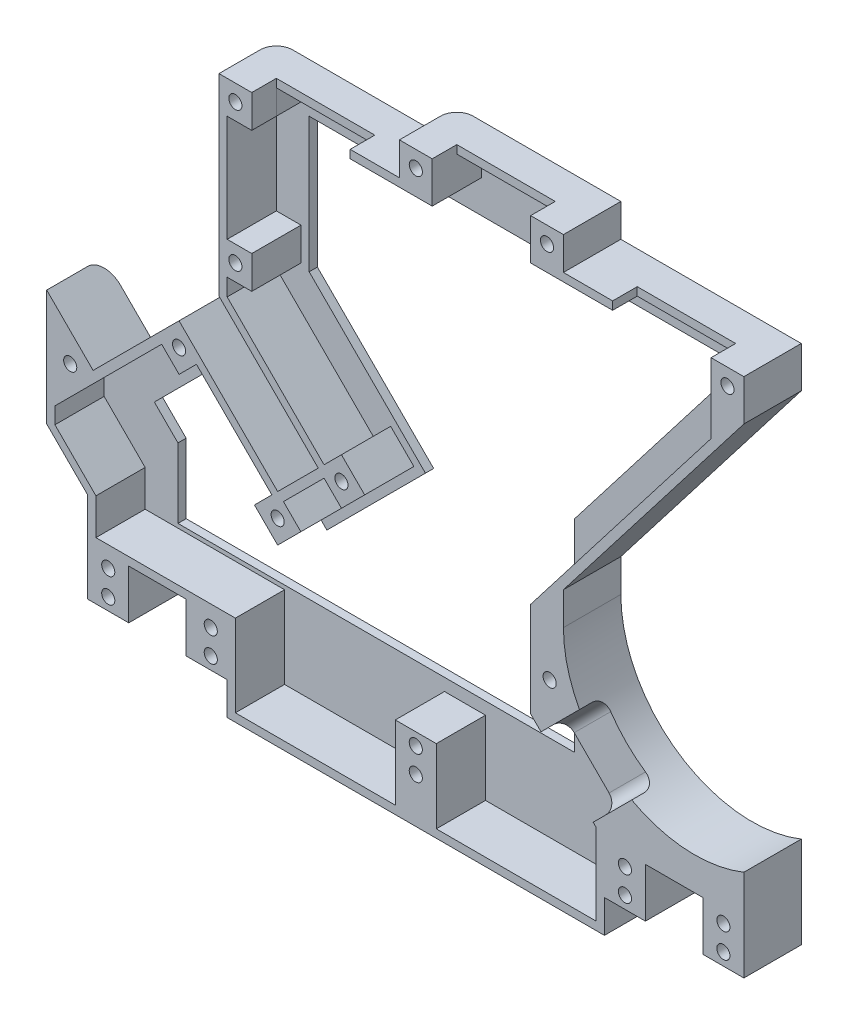
from build123d import *

# Parameters (mm, degrees)
BOSS_EXTRUDE1_DEPTH        = 1
BOSS_EXTRUDE3_DEPTH        = 7
FILLET1_R                  = 2
SKETCH5_R                  = 0.8
SCREW_HOLES_DEPTH          = 112.293530815
TUBE_START                 = 7
SKETCH6_W                  = 12
SKETCH6_H                  = 3.999999998
SKETCH6_H_2                = 3.99989697
TUBE_OPENINGS_FINGER_DEPTH = 3
TUBE_OPENINGS_THUMB_DEPTH  = 7
CUT_EXTRUDE1_DEPTH         = 112.293530962


with BuildPart() as part:
    # Sketch1 → Boss-Extrude1 (new body)
    with BuildSketch(Plane.XY):
        with BuildLine():
            Line((21, 67.500000006), (21, 43.999896977))
            Line((21, 43.999896977), (33.106562233, 31.893334743))
            Line((33.106562233, 31.893334743), (28.156814765, 26.943587275))
            Line((28.156814765, 26.943587275), (16.135999485, 38.964402555))
            Line((16.135999485, 38.964402555), (5.656854249, 28.48525732))
            Line((5.656854249, 28.48525732), (0, 34.14211157))
            Line((0, 34.14211157), (0, 20.000000004))
            Line((0, 20.000000004), (5, 15.000000004))
            Line((5, 15.000000004), (5, 10.000000004))
            Line((5, 10.000000004), (22, 10.000000004))
            Line((22, 10.000000004), (22, 4e-09))
            Line((22, 4e-09), (68, 4e-09))
            Line((68, 4e-09), (68, 10.000000004))
            Line((68, 10.000000004), (85, 10.000000004))
            Line((85, 10.000000004), (85, 15.167603026))
            ThreePointArc((85, 15.167603026), (70.05572809, 16.733500841), (63, 30.000000002))
            Line((63, 30.000000002), (63, 34.000000006))
            Line((63, 34.000000006), (85, 62.500000006))
            Line((85, 62.500000006), (85, 67.500000006))
            Line((85, 67.500000006), (63, 67.500000006))
            Line((63, 67.500000006), (63, 71.500000009))
            Line((63, 71.500000009), (43, 71.500000009))
            Line((43, 71.500000009), (43, 67.500000006))
            Line((43, 67.500000006), (21, 67.500000006))
        make_face()
    extrude(amount=BOSS_EXTRUDE1_DEPTH)

    # Sketch4 → Boss-Extrude3 (add)
    with BuildSketch(Plane.XY):
        with BuildLine():
            Line((21, 67.500000001), (21, 43.999896972))
            Line((21, 43.999896972), (33.106562233, 31.893334739))
            Line((33.106562233, 31.893334739), (28.156814765, 26.943587271))
            Line((28.156814765, 26.943587271), (16.135999485, 38.964402551))
            Line((16.135999485, 38.964402551), (5.656854249, 28.485257316))
            Line((5.656854249, 28.485257316), (0, 34.142111565))
            Line((0, 34.142111565), (0, 20))
            Line((0, 20), (5, 15))
            Line((5, 15), (5, 4))
            Line((5, 4), (10, 4))
            Line((10, 4), (10, 10))
            Line((10, 10), (17, 10))
            Line((17, 10), (17, 4))
            Line((17, 4), (22, 4))
            Line((22, 4), (22, 0))
            Line((22, 0), (68, 0))
            Line((68, 0), (68, 4))
            Line((68, 4), (73, 4))
            Line((73, 4), (73, 10))
            Line((73, 10), (80, 10))
            Line((80, 10), (80, 4))
            Line((80, 4), (85, 4))
            Line((85, 4), (85, 10))
            Line((85, 10), (85, 15.167603026))
            ThreePointArc((85, 15.167603026), (70.05572809, 16.733500841), (63, 30.000000002))
            Line((63, 30.000000002), (63, 34.000000006))
            Line((63, 34.000000006), (85, 62.500000006))
            Line((85, 62.500000006), (85, 67.500000004))
            Line((85, 67.500000004), (63, 67.500000004))
            Line((63, 67.500000004), (63, 71.500000004))
            Line((63, 71.500000004), (43, 71.500000004))
            Line((43, 71.500000004), (43, 67.500000001))
            Line((43, 67.500000001), (21, 67.500000001))
        make_face()
        Polygon((25, 66.500000001), (47, 66.500000001), (47, 70.500000001), (59, 70.500000001), (59, 66.500000001), (81, 66.500000001), (81, 58.954703281), (59.000000001, 30.454703282), (59.000000001, 18.88730163), (67, 10.887301631), (67, 1.000000001), (47.5, 1.000000001), (47.5, 9.999896972), (42.5, 9.999896972), (42.5, 1.000000001), (23, 1.000000001), (23, 11.000000001), (6, 11.000000001), (6, 15.414213562), (1, 20.414213562), (1, 22.414189504), (14.014679141, 35.428868645), (16.135999485, 33.307548301), (18.257319828, 35.428868645), (27.449707984, 26.23648049), (25.32838764, 24.115160146), (28.156814765, 21.286733021), (30.98524189, 24.115160146), (28.863921546, 26.23648049), (33.813669014, 31.186227958), (35.934989358, 29.064907614), (38.763416483, 31.893334739), (35.934989358, 34.721761864), (33.813669014, 32.60044152), (22, 44.414110535), (22, 46.499896972), (25, 46.499896972), (25, 50.499896972), (22, 50.499896972), (22, 63.500000001), (25, 63.500000001), align=None, mode=Mode.SUBTRACT)
    extrude(amount=BOSS_EXTRUDE3_DEPTH)

    # Fillet1
    # the kernel refuses this fillet: 2 mm, written as the material it takes off along each edge
    with BuildSketch(Plane(origin=(5, -1, 0), x_dir=(1, 0, 0), z_dir=(0, 1, 0))) as fillet1_piece_1_section:
        with BuildLine():
            CenterArc((FILLET1_R, -FILLET1_R), FILLET1_R, 90, 90)
            Line((0, -FILLET1_R), (0, 0))
            Line((0, 0), (FILLET1_R, 0))
        make_face()
    fillet1_piece_1 = extrude(amount=21.000000002, mode=Mode.PRIVATE)
    fillet1_piece_1 = split(fillet1_piece_1, bisect_by=Plane(origin=(9.33062451, 10.669375495, 0.459854315), z_dir=(-0.7071067811865478, -0.7071067811865474, 0)), keep=Keep.TOP, mode=Mode.PRIVATE)
    add(fillet1_piece_1, mode=Mode.SUBTRACT)
    with BuildSketch(Plane(origin=(-3.535533906, 23.53553391, 0), x_dir=(0.7071067811865478, 0.7071067811865474, 0), z_dir=(0.7071067811865474, -0.7071067811865478, 0))) as fillet1_piece_2_section:
        with BuildLine():
            CenterArc((FILLET1_R, FILLET1_R), FILLET1_R, 180, 90)
            Line((0, FILLET1_R), (0, 0))
            Line((0, 0), (FILLET1_R, 0))
        make_face()
    fillet1_piece_2 = extrude(amount=17.071067812, mode=Mode.PRIVATE)
    fillet1_piece_2 = split(fillet1_piece_2, bisect_by=Plane(origin=(5, 19.731051669, 0.462243165), z_dir=(-1, 0, 0)), keep=Keep.TOP, mode=Mode.PRIVATE)
    add(fillet1_piece_2, mode=Mode.SUBTRACT)
    with BuildSketch(Plane(origin=(0, 39.14211157, 0), x_dir=(1, 0, 0), z_dir=(0, -1, 0))) as fillet1_piece_3:
        with BuildLine():
            CenterArc((FILLET1_R, FILLET1_R), FILLET1_R, 180, 90)
            Line((0, FILLET1_R), (0, 0))
            Line((0, 0), (FILLET1_R, 0))
        make_face()
    extrude(amount=24.142111565, mode=Mode.SUBTRACT)
    with BuildSketch(Plane(origin=(21, 72.500000006, 0), x_dir=(0, 0, 1), z_dir=(0, -1, 0))) as fillet1_piece_4:
        with BuildLine():
            CenterArc((FILLET1_R, -FILLET1_R), FILLET1_R, 90, 90)
            Line((0, -FILLET1_R), (0, 0))
            Line((0, 0), (FILLET1_R, 0))
        make_face()
    extrude(amount=33.500103029, mode=Mode.SUBTRACT)
    with BuildSketch(Plane(origin=(43, 76.500000009, 0), x_dir=(1, 0, 0), z_dir=(0, -1, 0))) as fillet1_piece_5:
        with BuildLine():
            CenterArc((FILLET1_R, FILLET1_R), FILLET1_R, 180, 90)
            Line((0, FILLET1_R), (0, 0))
            Line((0, 0), (FILLET1_R, 0))
        make_face()
    extrude(amount=9.000000003, mode=Mode.SUBTRACT)
    with BuildSketch(Plane(origin=(-3.535533906, 23.53553391, 0), x_dir=(0.7071067811865478, 0.7071067811865474, 0), z_dir=(0.7071067811865474, -0.7071067811865478, 0))) as fillet1_piece_6a_section:
        with BuildLine():
            CenterArc((FILLET1_R, FILLET1_R), FILLET1_R, 180, 90)
            Line((0, FILLET1_R), (0, 0))
            Line((0, 0), (FILLET1_R, 0))
        make_face()
    fillet1_piece_6a = extrude(amount=17.071067812, mode=Mode.PRIVATE)
    fillet1_piece_6a = split(fillet1_piece_6a, bisect_by=Plane(origin=(5, 13.748651589, 0.432648826), z_dir=(1, 0, 0)), keep=Keep.TOP, mode=Mode.PRIVATE)
    with BuildSketch(Plane(origin=(5, -1, 0), x_dir=(1, 0, 0), z_dir=(0, 1, 0))) as fillet1_piece_6b_section:
        with BuildLine():
            CenterArc((FILLET1_R, -FILLET1_R), FILLET1_R, 90, 90)
            Line((0, -FILLET1_R), (0, 0))
            Line((0, 0), (FILLET1_R, 0))
        make_face()
    fillet1_piece_6b = extrude(amount=21.000000002, mode=Mode.PRIVATE)
    fillet1_piece_6b = split(fillet1_piece_6b, bisect_by=Plane(origin=(4.11516305, 15.884836954, 0.432648826), z_dir=(0.7071067811865478, 0.7071067811865474, 0)), keep=Keep.TOP, mode=Mode.PRIVATE)
    fillet1_piece_6 = fillet1_piece_6a & fillet1_piece_6b
    add(fillet1_piece_6, mode=Mode.SUBTRACT)

    # Sketch5 → Screw Holes (cut, through all)
    with BuildSketch(Plane.XY):
        with Locations((35.934989358, 31.893334739)):
            Circle(SKETCH5_R)
        with Locations((83, 65.500000004)):
            Circle(SKETCH5_R)
        with Locations((61.322330471, 23.636038972)):
            Circle(SKETCH5_R)
        with Locations(Location((23, 65.499896972, 0), (0, 0, 269.999999995))):
            Circle(SKETCH5_R)
        with Locations(Location((45, 69.499896972, 0), (0, 0, 269.999999995))):
            Circle(SKETCH5_R)
        with Locations((61, 69.499896972)):
            Circle(SKETCH5_R)
        with Locations((16.135999485, 36.135975426)):
            Circle(SKETCH5_R)
        with Locations((28.156814765, 24.115160146)):
            Circle(SKETCH5_R)
        with Locations(Location((23, 48.499896972, 0), (0, 0, 269.999999995))):
            Circle(SKETCH5_R)
        with Locations((45, 8.499896972)):
            Circle(SKETCH5_R)
        with Locations((82.5, 5.499896972)):
            Circle(SKETCH5_R)
        with Locations((82.5, 8.499896972)):
            Circle(SKETCH5_R)
        with Locations((70.5, 5.499896972)):
            Circle(SKETCH5_R)
        with Locations((70.5, 8.499896972)):
            Circle(SKETCH5_R)
        with Locations(Location((7.5, 5.499896972, 0), (0, 0, 128.682187454))):
            Circle(SKETCH5_R)
        with Locations(Location((7.5, 8.499896972, 0), (0, 0, 128.682187454))):
            Circle(SKETCH5_R)
        with Locations((20, 5.499896972)):
            Circle(SKETCH5_R)
        with Locations((20, 8.499896972)):
            Circle(SKETCH5_R)
        with Locations((45, 5.499896972)):
            Circle(SKETCH5_R)
        with Locations((2.863961031, 27.778150535)):
            Circle(SKETCH5_R)
    extrude(amount=SCREW_HOLES_DEPTH, mode=Mode.SUBTRACT)

    # Sketch6 → Tube Openings - Finger (cut)
    with BuildSketch(Plane.XY.offset(TUBE_START)):
        with Locations((53.000000002, 69.500000002)):
            Rectangle(SKETCH6_W, SKETCH6_H)
        Polygon((25, 67.500000001), (37.000000002, 67.500000001), (37.000000002, 63.500103034), (24.999896971, 63.500103034), align=None)
        with Locations((75.000000002, 65.500051519)):
            Rectangle(SKETCH6_W, SKETCH6_H_2)
    extrude(amount=-TUBE_OPENINGS_FINGER_DEPTH, mode=Mode.SUBTRACT)

    # Sketch9 → Tube Openings - Thumb (cut)
    with BuildSketch(Plane(origin=(38.943650815, 38.943650815, 0), x_dir=(0, 0, 1), z_dir=(-0.7071067811865472, -0.7071067811865478, 0))):
        with BuildLine():
            Line((7, -30.148232277), (5.5, -30.148232277))
            ThreePointArc((5.5, -30.148232277), (4.439339828, -30.587572106), (4, -31.648232277))
            Line((4, -31.648232277), (4, -37.648232277))
            ThreePointArc((4, -37.648232277), (4.439339828, -38.708892449), (5.5, -39.148232277))
            Line((5.5, -39.148232277), (7, -39.148232277))
            Line((7, -39.148232277), (7, -30.148232277))
        make_face()
    extrude(amount=-TUBE_OPENINGS_THUMB_DEPTH, mode=Mode.SUBTRACT)

    # Sketch10 → Cut-Extrude1 (cut, through all)
    with BuildSketch(Plane.XY):
        Polygon((58.322330471, 11.499896972), (10, 11.499896972), (10, 20.000000004), (7.121332373, 22.878667632), (16.135999485, 31.893334743), (28.156814765, 19.872519463), (40.177630045, 31.893334743), (26, 46.070964788), (26, 62.500000006), (78.683601394, 62.500000006), (58.322330471, 36.122899038), align=None)
    extrude(amount=CUT_EXTRUDE1_DEPTH, mode=Mode.SUBTRACT)


solid = part.part
